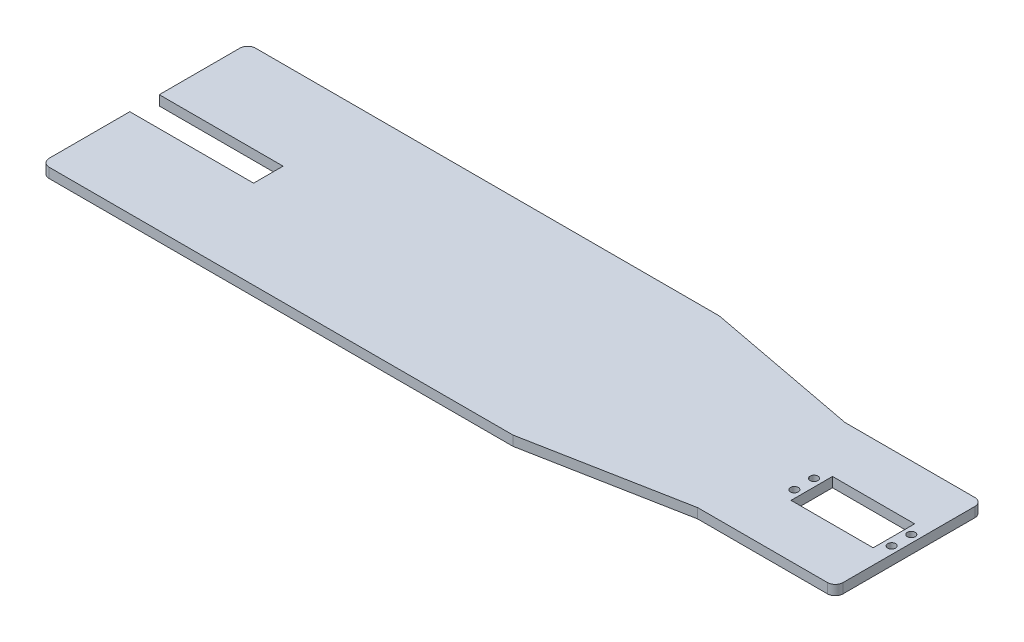
from build123d import *

# Parameters (mm, degrees)
BOSS_EXTRUDE1_DEPTH = 5
SKETCH2_R           = 2
SKETCH2_W           = 41.8
SKETCH2_H           = 21.1
CUT_EXTRUDE2_DEPTH  = 10
FILLET1_R           = 4


with BuildPart() as part:
    # Sketch1 → Boss-Extrude1 (new body)
    with BuildSketch(Plane(origin=(0, 0, 0), x_dir=(1, 0, 0), z_dir=(0, 1, 0))):
        Polygon((-120, 7.5), (-120, 52.5), (120, 52.5), (199, 37.5), (269, 37.5), (269, -37.5), (199, -37.5), (120, -52.5), (-120, -52.5), (-120, -7.5), (-57, -7.5), (-57, 7.5), align=None)
    extrude(amount=BOSS_EXTRUDE1_DEPTH)

    # Sketch2 → Cut-Extrude2 (cut)
    with BuildSketch(Plane(origin=(0, 5, 0), x_dir=(1, 0, 0), z_dir=(0, 1, 0))):
        with Locations((265.2, 5)):
            Circle(SKETCH2_R)
        with Locations((265.2, -5)):
            Circle(SKETCH2_R)
        with Locations((215.7, -5)):
            Circle(SKETCH2_R)
        with Locations((215.7, 5)):
            Circle(SKETCH2_R)
        with Locations((240.45, 0)):
            Rectangle(SKETCH2_W, SKETCH2_H)
    extrude(amount=-CUT_EXTRUDE2_DEPTH, mode=Mode.SUBTRACT)

    # Fillet1
    fillet1_edges = [part.edges().sort_by_distance(p)[0] for p in [
        (-120, 2.5, -52.5),
        (-120, 2.5, 52.5),
        (269, 2.5, -37.5),
        (269, 2.5, 37.5),
    ]]
    fillet(fillet1_edges, radius=FILLET1_R)


solid = part.part
